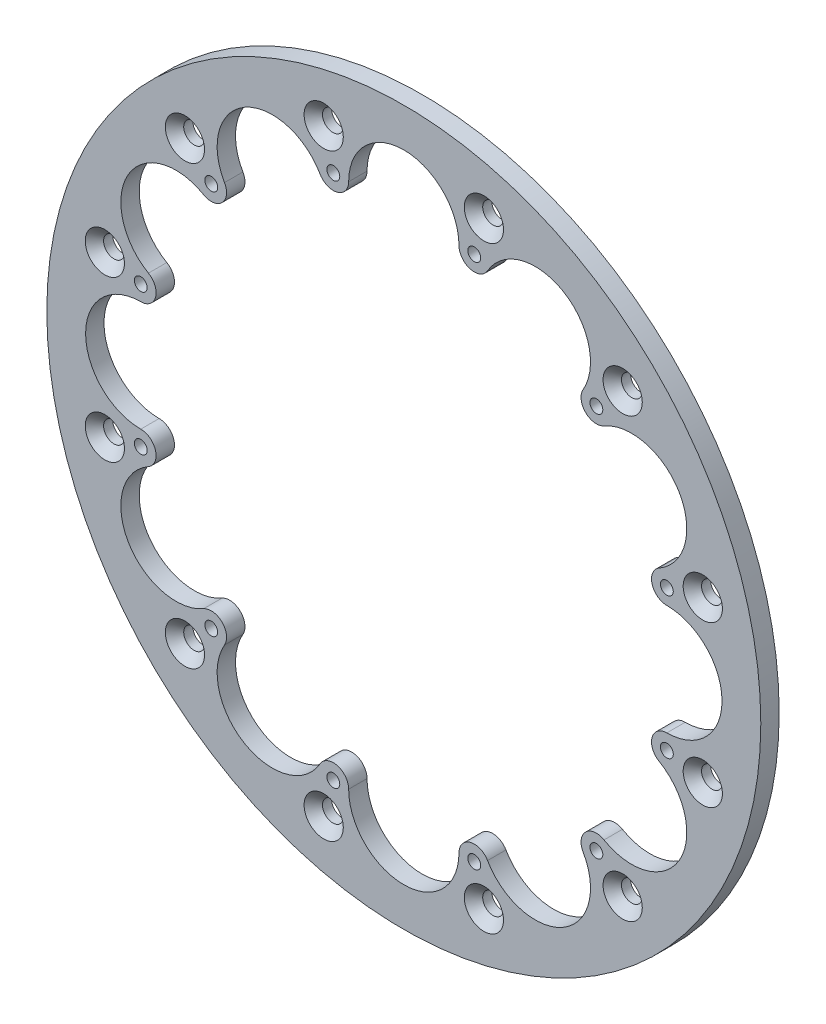
from build123d import *

# Parameters (mm, degrees)
EXTRUDE_1_OUTLINE_R      = 58.25
EXTRUDE_1_OUTLINE_R_2    = 1.55
EXTRUDE_1_OUTLINE_R_3    = 1.05
EXTRUDE_1_OUTLINE_R_4    = 1.549999992
EXTRUDE_1_OUTLINE_R_5    = 1.550000008
EXTRUDE_1_DEPTH          = 3
PATTERN_CIRCULAR_1_COUNT = 12


# Read off the part's stored shape, not the designer's step: 凸台-拉伸1
with BuildPart() as part:
    # 凸台-拉伸1 outline → 凸台-拉伸1 (new body)
    with BuildSketch(Plane.XY):
        Circle(EXTRUDE_1_OUTLINE_R)
        with Locations((-35.710722211, -35.710722211)):
            Circle(EXTRUDE_1_OUTLINE_R_2, mode=Mode.SUBTRACT)
        with Locations((-31.418584049, -31.418584049)):
            Circle(EXTRUDE_1_OUTLINE_R_3, mode=Mode.SUBTRACT)
        with Locations((-13.071031517, -48.781753727)):
            Circle(EXTRUDE_1_OUTLINE_R_2, mode=Mode.SUBTRACT)
        with Locations((-11.499999913, -42.918583962)):
            Circle(EXTRUDE_1_OUTLINE_R_3, mode=Mode.SUBTRACT)
        with Locations((-48.781753727, -13.071031517)):
            Circle(EXTRUDE_1_OUTLINE_R_2, mode=Mode.SUBTRACT)
        with Locations((-42.918583962, -11.499999913)):
            Circle(EXTRUDE_1_OUTLINE_R_3, mode=Mode.SUBTRACT)
        with Locations((13.071031517, -48.781753727)):
            Circle(EXTRUDE_1_OUTLINE_R_4, mode=Mode.SUBTRACT)
        with Locations((11.499999913, -42.918583962)):
            Circle(EXTRUDE_1_OUTLINE_R_3, mode=Mode.SUBTRACT)
        with Locations((35.710722211, -35.710722211)):
            Circle(EXTRUDE_1_OUTLINE_R_2, mode=Mode.SUBTRACT)
        with Locations((31.418584049, -31.418584049)):
            Circle(EXTRUDE_1_OUTLINE_R_3, mode=Mode.SUBTRACT)
        with Locations((42.918583962, -11.499999913)):
            Circle(EXTRUDE_1_OUTLINE_R_3, mode=Mode.SUBTRACT)
        with Locations((48.781753727, -13.071031517)):
            Circle(EXTRUDE_1_OUTLINE_R_2, mode=Mode.SUBTRACT)
        with Locations((-48.781753727, 13.071031517)):
            Circle(EXTRUDE_1_OUTLINE_R_2, mode=Mode.SUBTRACT)
        with Locations((-42.918583962, 11.499999913)):
            Circle(EXTRUDE_1_OUTLINE_R_3, mode=Mode.SUBTRACT)
        with Locations((-31.418584049, 31.418584049)):
            Circle(EXTRUDE_1_OUTLINE_R_3, mode=Mode.SUBTRACT)
        with Locations((-35.710722211, 35.710722211)):
            Circle(EXTRUDE_1_OUTLINE_R_2, mode=Mode.SUBTRACT)
        with Locations((-11.499999913, 42.918583962)):
            Circle(EXTRUDE_1_OUTLINE_R_3, mode=Mode.SUBTRACT)
        with Locations((-13.071031517, 48.781753727)):
            Circle(EXTRUDE_1_OUTLINE_R_5, mode=Mode.SUBTRACT)
        with BuildLine():
            ThreePointArc((-42.918891796, 8.999999932), (-40.503769396, 10.8529523), (-41.668850564, 13.665217323))
            ThreePointArc((-41.668850564, 13.665217323), (-44.964038964, 25.96), (-32.668850632, 29.253674473))
            ThreePointArc((-32.668850632, 29.253674473), (-29.650817096, 29.650817096), (-29.253674473, 32.668850632))
            ThreePointArc((-29.253674473, 32.668850632), (-25.96, 44.964038964), (-13.665217323, 41.668850564))
            ThreePointArc((-13.665217323, 41.668850564), (-10.852952298, 40.503769388), (-8.999999924, 42.918891796))
            ThreePointArc((-8.999999924, 42.918891796), (0, 51.92), (8.999999932, 42.918891796))
            ThreePointArc((8.999999932, 42.918891796), (10.8529523, 40.503769396), (13.665217323, 41.668850564))
            ThreePointArc((13.665217323, 41.668850564), (25.96, 44.964038964), (29.253674473, 32.668850632))
            ThreePointArc((29.253674473, 32.668850632), (29.650817096, 29.650817096), (32.668850632, 29.253674473))
            ThreePointArc((32.668850632, 29.253674473), (44.964038964, 25.96), (41.668850564, 13.665217323))
            ThreePointArc((41.668850564, 13.665217323), (40.503769396, 10.8529523), (42.918891796, 8.999999932))
            ThreePointArc((42.918891796, 8.999999932), (51.92, 0), (42.918891796, -8.999999932))
            ThreePointArc((42.918891796, -8.999999932), (40.503769396, -10.8529523), (41.668850564, -13.665217323))
            ThreePointArc((41.668850564, -13.665217323), (44.964038964, -25.96), (32.668850632, -29.253674473))
            ThreePointArc((32.668850632, -29.253674473), (29.650817096, -29.650817096), (29.253674473, -32.668850632))
            ThreePointArc((29.253674473, -32.668850632), (25.96, -44.964038964), (13.665217323, -41.668850564))
            ThreePointArc((13.665217323, -41.668850564), (10.852952302, -40.503769404), (8.99999994, -42.918891796))
            ThreePointArc((8.99999994, -42.918891796), (0, -51.92), (-8.999999932, -42.918891796))
            ThreePointArc((-8.999999932, -42.918891796), (-10.8529523, -40.503769396), (-13.665217323, -41.668850564))
            ThreePointArc((-13.665217323, -41.668850564), (-25.96, -44.964038964), (-29.253674473, -32.668850632))
            ThreePointArc((-29.253674473, -32.668850632), (-29.650817096, -29.650817096), (-32.668850632, -29.253674473))
            ThreePointArc((-32.668850632, -29.253674473), (-44.964038964, -25.96), (-41.668850564, -13.665217323))
            ThreePointArc((-41.668850564, -13.665217323), (-40.503769396, -10.8529523), (-42.918891796, -8.999999932))
            ThreePointArc((-42.918891796, -8.999999932), (-51.92, 0), (-42.918891796, 8.999999932))
        make_face(mode=Mode.SUBTRACT)
        with Locations((42.918583962, 11.499999913)):
            Circle(EXTRUDE_1_OUTLINE_R_3, mode=Mode.SUBTRACT)
        with Locations((48.781753727, 13.071031517)):
            Circle(EXTRUDE_1_OUTLINE_R_2, mode=Mode.SUBTRACT)
        with Locations((11.499999913, 42.918583962)):
            Circle(EXTRUDE_1_OUTLINE_R_3, mode=Mode.SUBTRACT)
        with Locations((13.071031517, 48.781753727)):
            Circle(EXTRUDE_1_OUTLINE_R_2, mode=Mode.SUBTRACT)
        with Locations((31.418584049, 31.418584049)):
            Circle(EXTRUDE_1_OUTLINE_R_3, mode=Mode.SUBTRACT)
        with Locations((35.710722211, 35.710722211)):
            Circle(EXTRUDE_1_OUTLINE_R_2, mode=Mode.SUBTRACT)
    extrude(amount=EXTRUDE_1_DEPTH)

    # 草图4 → M3 开槽半沉头螺钉的锥形沉头孔1 (revolve, cut)
    with BuildSketch(Plane(origin=(-13.071031517, 48.781753727, 3), x_dir=(0, -1, 0), z_dir=(1, 0, 0))):
        Polygon((0, 0), (0, 21.021463052), (1.7, 20), (1.7, 1.5), (3.2, 0), align=None)
    hole_wizard_m3_1 = revolve(axis=Axis((-13.071031517, 48.781753727, 9.35), (0, 0, -1)), mode=Mode.SUBTRACT)

    # 阵列(圆周)1: M3 开槽半沉头螺钉的锥形沉头孔1 ×12 about axis
    pattern_circular_1_axis = Axis((0, 0, 0), (0, 0, 1))
    for i in range(1, PATTERN_CIRCULAR_1_COUNT):
        add(hole_wizard_m3_1.rotate(pattern_circular_1_axis, i * 360 / PATTERN_CIRCULAR_1_COUNT), mode=Mode.SUBTRACT)


solid = part.part
